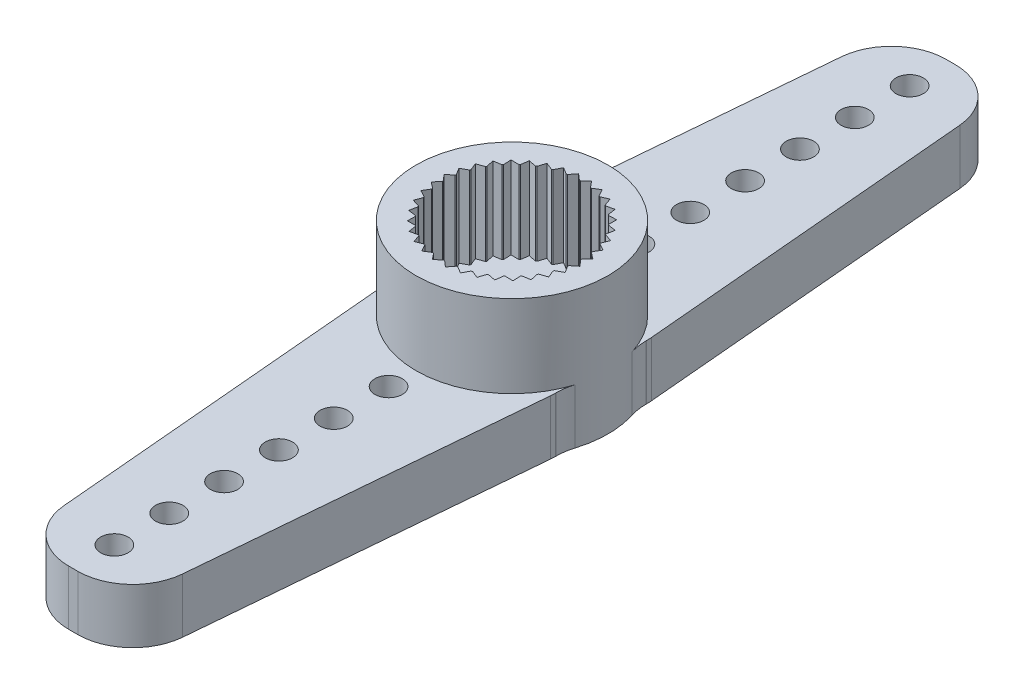
from build123d import *

# Parameters (mm, degrees)
BOSS_EXTRUDE1_DEPTH      = 2
FILLET1_R                = 2
BOSS_EXTRUDE2_DEPTH      = 3
BOSS_EXTRUDE2_DEPTH_BACK = 2
SKETCH2_R                = 3.5
SKETCH3_R                = 2.5
CUT_EXTRUDE1_DEPTH       = 1
SKETCH4_R                = 1
CUT_EXTRUDE2_DEPTH       = 17.8597153
CUT_EXTRUDE3_START       = -3
SKETCH5_R                = 2.5
CUT_EXTRUDE3_DEPTH       = 3
CUT_EXTRUDE4_DEPTH       = 3
CIRPATTERN1_COUNT        = 36
SKETCH9_R                = 0.5
CUT_EXTRUDE5_DEPTH       = 18.12454379
LPATTERN1_COUNT          = 6
LPATTERN1_PITCH          = 2
MIRROR1_COPY_1_SKETCH_R  = 0.5
MIRROR1_COPY_1_DEPTH     = 18.12454379
MIRROR1_COPY_2_SKETCH_R  = 0.5
MIRROR1_COPY_2_DEPTH     = 18.12454379
MIRROR1_COPY_3_SKETCH_R  = 0.5
MIRROR1_COPY_3_DEPTH     = 18.12454379
MIRROR1_COPY_4_SKETCH_R  = 0.5
MIRROR1_COPY_4_DEPTH     = 18.12454379
MIRROR1_COPY_5_SKETCH_R  = 0.5
MIRROR1_COPY_5_DEPTH     = 18.12454379
FILLET3_R                = 2


with BuildPart() as part:
    # Sketch1 → Boss-Extrude1 (new body)
    with BuildSketch(Plane(origin=(0, 0, 0), x_dir=(1, 0, 0), z_dir=(0, 1, 0))):
        Polygon((-3.25, -1.75), (-3.25, 1.75), (-2, 16), (2, 16), (3.25, 1.75), (3.25, -1.75), (2, -16), (-2, -16), align=None)
    extrude(amount=BOSS_EXTRUDE1_DEPTH)

    # Fillet1
    fillet1_edges = [part.edges().sort_by_distance(p)[0] for p in [
        (-2, 1, -16),
        (2, 1, -16),
        (2, 1, 16),
        (-2, 1, 16),
    ]]
    fillet(fillet1_edges, radius=FILLET1_R)

    # Sketch2 → Boss-Extrude2 (add, two sides: drawn at the far end of the back side and taken through both)
    with BuildSketch(Plane(origin=(0, 2, 0), x_dir=(1, 0, 0), z_dir=(0, 1, 0)).offset(-BOSS_EXTRUDE2_DEPTH_BACK)):
        with Locations(Location((0, 0, 0), (0, 0, 270))):
            Circle(SKETCH2_R)
    extrude(amount=BOSS_EXTRUDE2_DEPTH + BOSS_EXTRUDE2_DEPTH_BACK)

    # Sketch3 → Cut-Extrude1 (cut)
    with BuildSketch(Plane(origin=(0, 0, 0), x_dir=(-1, 0, 0), z_dir=(0, -1, 0))):
        with Locations(Location((0, 0, 0), (0, 0, 90))):
            Circle(SKETCH3_R)
    extrude(amount=-CUT_EXTRUDE1_DEPTH, mode=Mode.SUBTRACT)

    # Sketch4 → Cut-Extrude2 (cut, through all)
    with BuildSketch(Plane(origin=(0, 1, 0), x_dir=(-1, 0, 0), z_dir=(0, -1, 0))):
        with Locations(Location((0, 0, 0), (0, 0, 90))):
            Circle(SKETCH4_R)
    extrude(amount=-CUT_EXTRUDE2_DEPTH, mode=Mode.SUBTRACT)

    # Sketch5 → Cut-Extrude3 (cut)
    with BuildSketch(Plane(origin=(0, 5, 0), x_dir=(1, 0, 0), z_dir=(0, 1, 0)).offset(CUT_EXTRUDE3_START)):
        with Locations(Location((0, 0, 0), (0, 0, 90))):
            Circle(SKETCH5_R)
    extrude(amount=CUT_EXTRUDE3_DEPTH, mode=Mode.SUBTRACT)

    # Sketch6 → Cut-Extrude4 (cut)
    with BuildSketch(Plane(origin=(0, 5, 0), x_dir=(1, 0, 0), z_dir=(0, 1, 0))):
        Polygon((-2.5, 0), (-2.691676801, 0.211839558), (-2.469220851, 0.391086163), align=None)
    cut_extrude4 = extrude(amount=-CUT_EXTRUDE4_DEPTH, mode=Mode.SUBTRACT)

    # CirPattern1: Cut-Extrude4 ×36 about axis
    cirpattern1_axis = Axis((0, 0, 0), (0, 1, 0))
    for i in range(1, CIRPATTERN1_COUNT):
        add(cut_extrude4.rotate(cirpattern1_axis, i * 360 / CIRPATTERN1_COUNT), mode=Mode.SUBTRACT)

    # Sketch9 → Cut-Extrude5 (cut, through all)
    with BuildSketch(Plane(origin=(0, 0, 0), x_dir=(-1, 0, 0), z_dir=(0, -1, 0))):
        with Locations(Location((0, 14.5, 0), (0, 0, 90))):
            Circle(SKETCH9_R)
    cut_extrude5 = extrude(amount=-CUT_EXTRUDE5_DEPTH, mode=Mode.SUBTRACT)

    # LPattern1: Cut-Extrude5 ×6
    with Locations(*[(0, 0, i * LPATTERN1_PITCH) for i in range(1, LPATTERN1_COUNT)]):
        add(cut_extrude5, mode=Mode.SUBTRACT)

    # Mirror1: Cut-Extrude5 across plane
    add(cut_extrude5.mirror(Plane.XY), mode=Mode.SUBTRACT)

    # Mirror1 copy 1 sketch → Mirror1 copy 1 (cut, through all)
    with BuildSketch(Plane(origin=(0, 0, -2), x_dir=(-1, 0, 0), z_dir=(0, -1, 0))):
        with Locations((0, -14.5)):
            Circle(MIRROR1_COPY_1_SKETCH_R)
    extrude(amount=-MIRROR1_COPY_1_DEPTH, mode=Mode.SUBTRACT)

    # Mirror1 copy 2 sketch → Mirror1 copy 2 (cut, through all)
    with BuildSketch(Plane(origin=(0, 0, -4), x_dir=(-1, 0, 0), z_dir=(0, -1, 0))):
        with Locations((0, -14.5)):
            Circle(MIRROR1_COPY_2_SKETCH_R)
    extrude(amount=-MIRROR1_COPY_2_DEPTH, mode=Mode.SUBTRACT)

    # Mirror1 copy 3 sketch → Mirror1 copy 3 (cut, through all)
    with BuildSketch(Plane(origin=(0, 0, -6), x_dir=(-1, 0, 0), z_dir=(0, -1, 0))):
        with Locations((0, -14.5)):
            Circle(MIRROR1_COPY_3_SKETCH_R)
    extrude(amount=-MIRROR1_COPY_3_DEPTH, mode=Mode.SUBTRACT)

    # Mirror1 copy 4 sketch → Mirror1 copy 4 (cut, through all)
    with BuildSketch(Plane(origin=(0, 0, -8), x_dir=(-1, 0, 0), z_dir=(0, -1, 0))):
        with Locations((0, -14.5)):
            Circle(MIRROR1_COPY_4_SKETCH_R)
    extrude(amount=-MIRROR1_COPY_4_DEPTH, mode=Mode.SUBTRACT)

    # Mirror1 copy 5 sketch → Mirror1 copy 5 (cut, through all)
    with BuildSketch(Plane(origin=(0, 0, -10), x_dir=(-1, 0, 0), z_dir=(0, -1, 0))):
        with Locations((0, -14.5)):
            Circle(MIRROR1_COPY_5_SKETCH_R)
    extrude(amount=-MIRROR1_COPY_5_DEPTH, mode=Mode.SUBTRACT)

    # Fillet3
    # the kernel refuses this fillet: 2 mm, written as the material it adds along each edge
    with BuildSketch(Plane(origin=(-3.25, 0, 1.299038106), x_dir=(-0.33486149994796977, 0, -0.9422673590083633), z_dir=(0, 1, 0))) as fillet3_piece_1:
        with BuildLine():
            CenterArc((0.349049135, 1.998495294), FILLET3_R, 250.435883949, 17.341442803)
            Line((-0.320673865, 0.113960576), (0, 0))
            ThreePointArc((0, 0), (0.13574133, 0.002633235), (0.271482661, 0))
        make_face()
    extrude(amount=2)
    with BuildSketch(Plane(origin=(3.25, 0, 1.299038106), x_dir=(0.3348614999479675, 0, -0.942267359008364), z_dir=(0, 1, 0))) as fillet3_piece_2:
        with BuildLine():
            CenterArc((0.349049135, -1.998495294), FILLET3_R, 92.222673248, 17.341442803)
            Line((-0.320673865, -0.113960576), (0, 0))
            ThreePointArc((0, 0), (0.13574133, -0.002633235), (0.271482661, 0))
        make_face()
    extrude(amount=2)
    with BuildSketch(Plane(origin=(-3.25, 0, -1.299038106), x_dir=(0, 0, -1), z_dir=(0, 1, 0))) as fillet3_piece_3:
        with BuildLine():
            CenterArc((0.340321525, 2), FILLET3_R, 252.658557197, 17.341442803)
            ThreePointArc((-0.25580925, 0.090909091), (-0.127022856, 0.047935757), (0, 0))
            Line((0, 0), (0.340321525, 0))
        make_face()
    extrude(amount=2)
    with BuildSketch(Plane(origin=(3.25, 0, -1.299038106), x_dir=(0, 0, -1), z_dir=(0, 1, 0))) as fillet3_piece_4:
        with BuildLine():
            CenterArc((0.340321525, -2), FILLET3_R, 90, 17.341442803)
            ThreePointArc((-0.25580925, -0.090909091), (-0.127022856, -0.047935757), (0, 0))
            Line((0, 0), (0.340321525, 0))
        make_face()
    extrude(amount=2)
    # the kernel refuses this fillet: 2 mm, written as the material it takes off along each edge
    with BuildSketch(Plane(origin=(3.25, -0.218878004, -1.75), x_dir=(0, 0, 1), z_dir=(0, 1, 0)), Plane(origin=(3.25, -0.218878004, 1.75), x_dir=(-0.08738374771484606, 0, 0.9961747239492218), z_dir=(0, 1, 0)), Plane(origin=(-3.25, -0.218878004, -1.75), x_dir=(0.08738374771484518, 0, -0.9961747239492218), z_dir=(0, 1, 0))) as fillet3_2_piece_1:
        with BuildLine():
            CenterArc((FILLET3_R * 0.043775600736, -FILLET3_R), FILLET3_R, 90, 5.013113755)
            Line((-FILLET3_R * 0.0436081469789, -FILLET3_R * 0.00382527605078), (0, 0))
            Line((0, 0), (FILLET3_R * 0.043775600736, 0))
        make_face()
    extrude(amount=2.437756007, mode=Mode.SUBTRACT)
    with BuildSketch(Plane(origin=(-3.25, -0.218878004, 1.75), x_dir=(0.08738374771484235, 0, 0.996174723949222), z_dir=(0, 1, 0))) as fillet3_2_piece_2:
        with BuildLine():
            CenterArc((FILLET3_R * 0.043775600736, FILLET3_R), FILLET3_R, 264.986886245, 5.013113755)
            Line((-FILLET3_R * 0.0436081469789, FILLET3_R * 0.00382527605078), (0, 0))
            Line((0, 0), (FILLET3_R * 0.043775600736, 0))
        make_face()
    extrude(amount=2.437756007, mode=Mode.SUBTRACT)


solid = part.part
